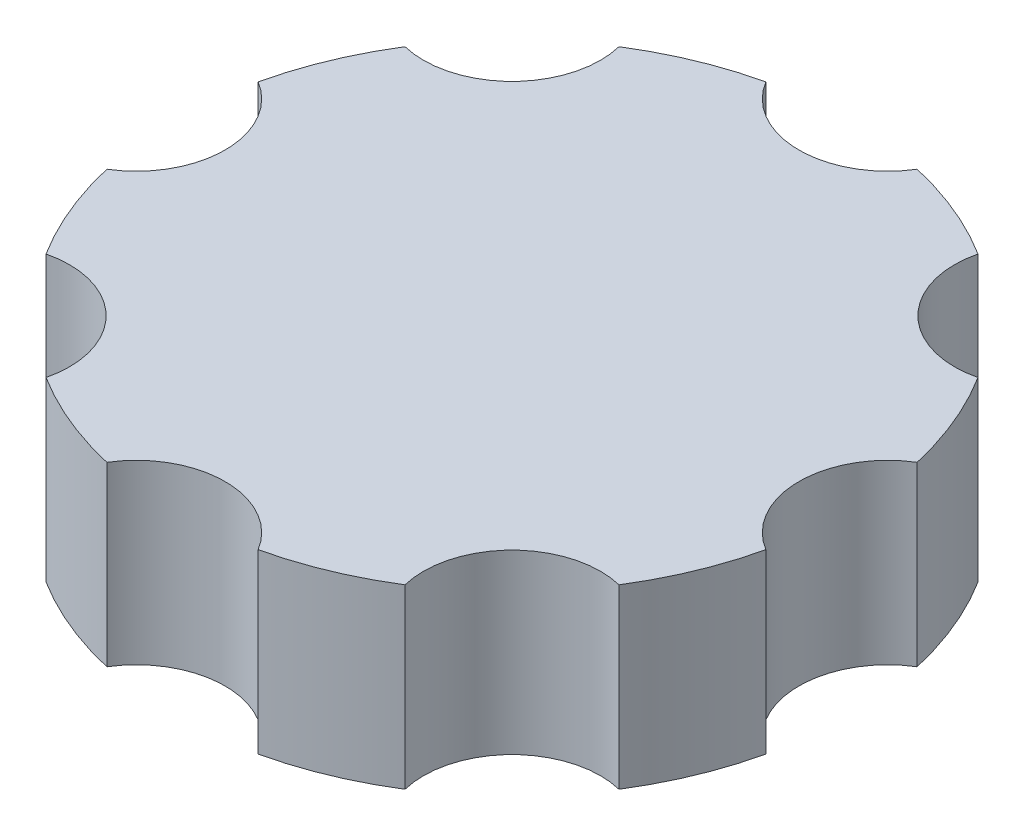
from build123d import *

# Parameters (mm, degrees)
BOSS_EXTRUDE1_DEPTH = 10


with BuildPart() as part:
    # Sketch1 → Boss-Extrude1 (new body)
    with BuildSketch(Plane(origin=(0, 0, 0), x_dir=(1, 0, 0), z_dir=(0, 1, 0))):
        with BuildLine():
            ThreePointArc((4.271894751, -18.607264577), (0, -16.20551692), (-4.271894751, -18.607264577))
            ThreePointArc((-4.271894751, -18.607264577), (-7.30594069, -17.6381011), (-10.136637215, -16.178008708))
            ThreePointArc((-10.136637215, -16.178008708), (-11.459030907, -11.459030907), (-16.178008708, -10.136637215))
            ThreePointArc((-16.178008708, -10.136637215), (-17.6381011, -7.30594069), (-18.607264577, -4.271894751))
            ThreePointArc((-18.607264577, -4.271894751), (-16.20551692, 0), (-18.607264577, 4.271894751))
            ThreePointArc((-18.607264577, 4.271894751), (-17.6381011, 7.30594069), (-16.178008708, 10.136637215))
            ThreePointArc((-16.178008708, 10.136637215), (-11.459030907, 11.459030907), (-10.136637215, 16.178008708))
            ThreePointArc((-10.136637215, 16.178008708), (-7.30594069, 17.6381011), (-4.271894751, 18.607264577))
            ThreePointArc((-4.271894751, 18.607264577), (0, 16.20551692), (4.271894751, 18.607264577))
            ThreePointArc((4.271894751, 18.607264577), (7.30594069, 17.6381011), (10.136637215, 16.178008708))
            ThreePointArc((10.136637215, 16.178008708), (11.459030907, 11.459030907), (16.178008708, 10.136637215))
            ThreePointArc((16.178008708, 10.136637215), (17.6381011, 7.30594069), (18.607264577, 4.271894751))
            ThreePointArc((18.607264577, 4.271894751), (16.20551692, 0), (18.607264577, -4.271894751))
            ThreePointArc((18.607264577, -4.271894751), (17.6381011, -7.30594069), (16.178008708, -10.136637215))
            ThreePointArc((16.178008708, -10.136637215), (11.459030907, -11.459030907), (10.136637215, -16.178008708))
            ThreePointArc((10.136637215, -16.178008708), (7.30594069, -17.6381011), (4.271894751, -18.607264577))
        make_face()
    extrude(amount=BOSS_EXTRUDE1_DEPTH)


solid = part.part
